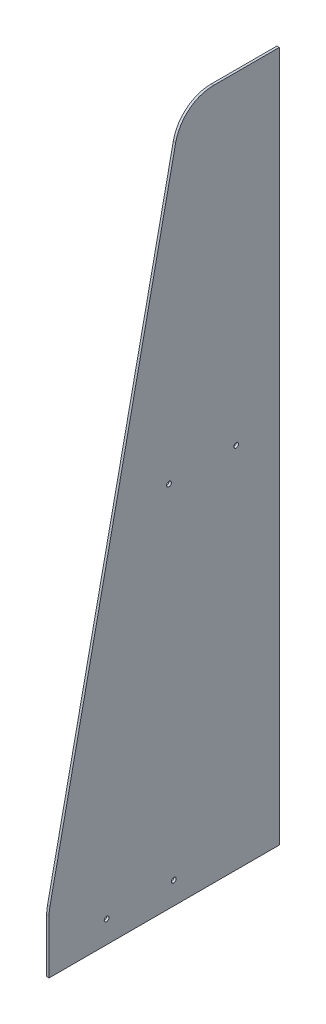
from build123d import *

# Parameters (mm, degrees)
BOSS_EXTRUDE2_DEPTH = 3.175
SKETCH10_W          = 12.7
SKETCH10_H          = 914.4
CUT_EXTRUDE1_DEPTH  = 42.418


with BuildPart() as part:
    # Sketch1 → Boss-Extrude2 (new body)
    with BuildSketch(Plane(origin=(0, 0, 0), x_dir=(0, 0, -1), z_dir=(1, 0, 0))):
        with BuildLine():
            Line((-317.5, 0), (0, 0))
            Line((0, 0), (0, 50.8))
            Line((0, 50.8), (0, 101.6))
            Line((0, 101.6), (0, 559.756235294))
            Line((0, 559.756235294), (0, 863.6))
            Line((0, 863.6), (0, 914.4))
            Line((0, 914.4), (-100.150182785, 914.4))
            ThreePointArc((-100.150182785, 914.4), (-132.16586597, 903.041552077), (-149.864680249, 874.045513001))
            Line((-149.864680249, 874.045513001), (-316.414497465, 81.366353538))
            ThreePointArc((-316.414497465, 81.366353538), (-317.227895618, 76.171722787), (-317.5, 70.920840537))
            Line((-317.5, 70.920840537), (-317.5, 0))
        make_face()
        with BuildLine():
            ThreePointArc((-244.475, 29.604131036), (-241.3, 32.779131036), (-238.125, 29.604131036))
            ThreePointArc((-238.125, 29.604131036), (-241.3, 26.429131036), (-244.475, 29.604131036))
        make_face(mode=Mode.SUBTRACT)
        with BuildLine():
            ThreePointArc((-149.225, 29.604131036), (-152.4, 26.429131036), (-155.575, 29.604131036))
            ThreePointArc((-155.575, 29.604131036), (-152.4, 32.779131036), (-149.225, 29.604131036))
        make_face(mode=Mode.SUBTRACT)
        with BuildLine():
            ThreePointArc((-161.925, 486.804131036), (-158.75, 489.979131036), (-155.575, 486.804131036))
            ThreePointArc((-155.575, 486.804131036), (-158.75, 483.629131036), (-161.925, 486.804131036))
        make_face(mode=Mode.SUBTRACT)
        with BuildLine():
            ThreePointArc((-66.675, 486.804131036), (-69.85, 483.629131036), (-73.025, 486.804131036))
            ThreePointArc((-73.025, 486.804131036), (-69.85, 489.979131036), (-66.675, 486.804131036))
        make_face(mode=Mode.SUBTRACT)
    extrude(amount=BOSS_EXTRUDE2_DEPTH)

    # Sketch10 → Cut-Extrude1 (cut)
    with BuildSketch(Plane.ZY):
        with Locations((6.35, 457.2)):
            Rectangle(SKETCH10_W, SKETCH10_H)
    extrude(amount=-CUT_EXTRUDE1_DEPTH, mode=Mode.SUBTRACT)


solid = part.part
